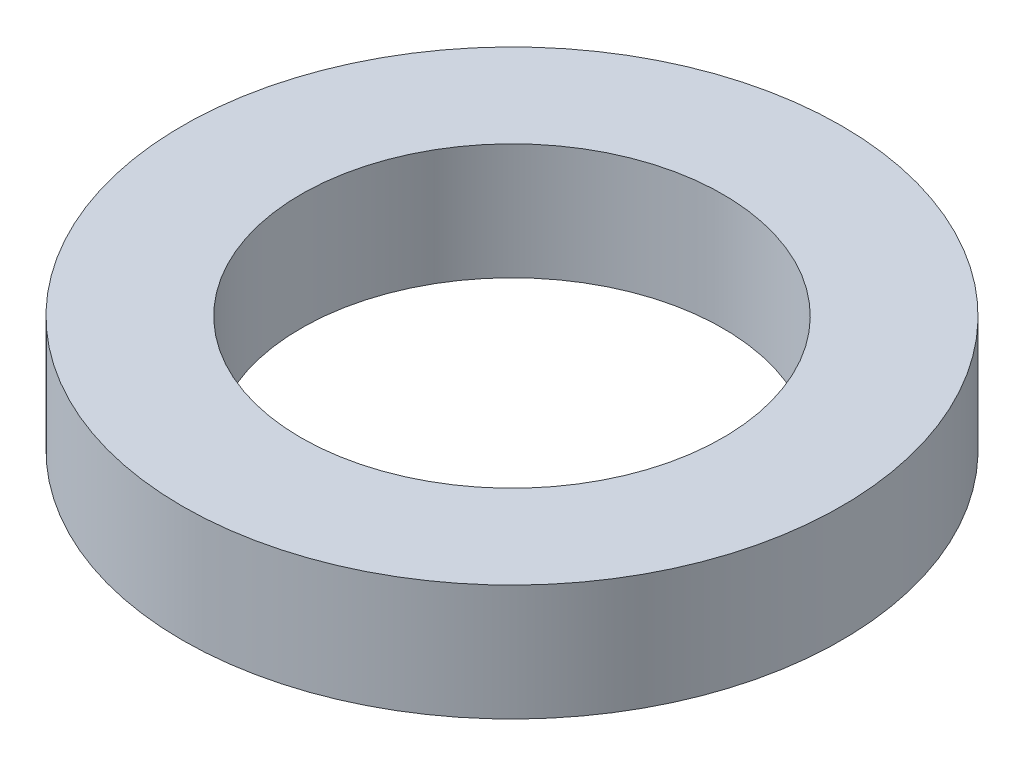
from build123d import *

# Parameters (mm, degrees)
SKETCH1_R           = 62.5
BOSS_EXTRUDE1_DEPTH = 22
SKETCH2_R           = 40
CUT_EXTRUDE1_DEPTH  = 92.08512502


with BuildPart() as part:
    # Sketch1 → Boss-Extrude1 (new body)
    with BuildSketch(Plane(origin=(0, 0, 0), x_dir=(1, 0, 0), z_dir=(0, 1, 0))):
        Circle(SKETCH1_R)
    extrude(amount=BOSS_EXTRUDE1_DEPTH)

    # Sketch2 → Cut-Extrude1 (cut, through all)
    with BuildSketch(Plane(origin=(0, 0, 0), x_dir=(1, 0, 0), z_dir=(0, 1, 0))):
        Circle(SKETCH2_R)
    extrude(amount=CUT_EXTRUDE1_DEPTH, mode=Mode.SUBTRACT)


solid = part.part
